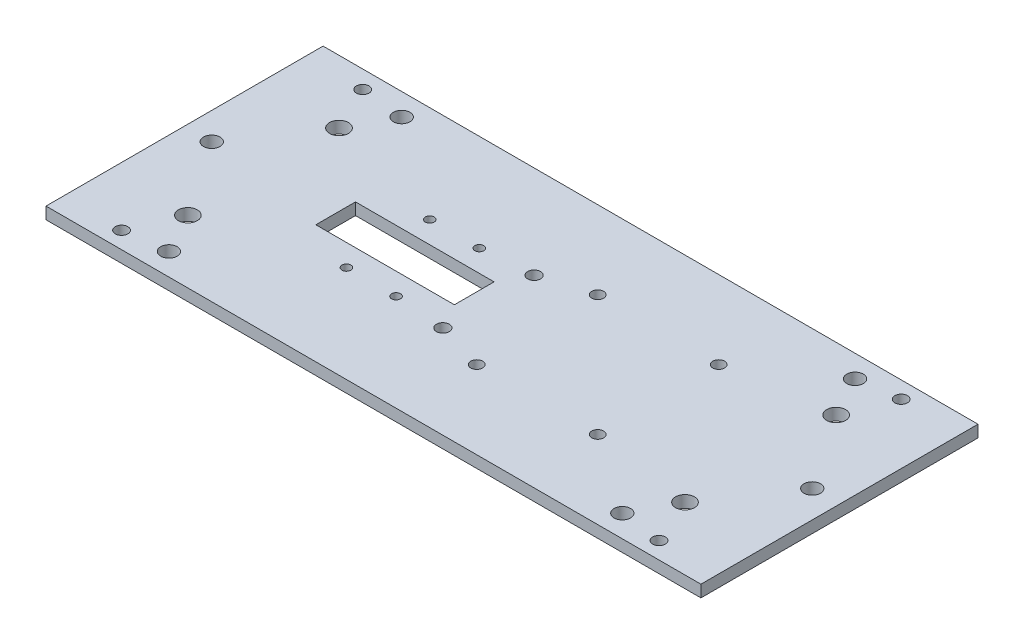
from build123d import *

# Parameters (mm, degrees)
SKETCH1_W           = 165.1
SKETCH1_H           = 69.85
BOSS_EXTRUDE1_DEPTH = 3
CUT_EXTRUDE1_REACH  = 91.684
SKETCH6_W           = 34.925
SKETCH6_H           = 10
SKETCH6_R           = 1.5
SKETCH6_R_2         = 1.625
CUT_EXTRUDE3_REACH  = 91.684
SKETCH8_R           = 2.38125
SKETCH9_R           = 2.0828
CUT_EXTRUDE5_DEPTH  = 5.08
SKETCH10_R          = 2.0828
CUT_EXTRUDE6_DEPTH  = 5.08
SKETCH11_R          = 1.125
SKETCH11_R_2        = 1.125000036
CUT_EXTRUDE7_DEPTH  = 41.91
SKETCH13_R          = 1.5875
CUT_EXTRUDE9_DEPTH  = 5


with BuildPart() as part:
    # Sketch1 → Boss-Extrude1 (new body)
    with BuildSketch(Plane(origin=(0, 0, 0), x_dir=(1, 0, 0), z_dir=(0, 1, 0))):
        Rectangle(SKETCH1_W, SKETCH1_H)
    extrude(amount=BOSS_EXTRUDE1_DEPTH)

    # Sketch6 → Cut-Extrude1 (cut, up to next)
    with BuildSketch(Plane.XZ, mode=Mode.PRIVATE) as cut_extrude1_sk1:
        with Locations((-26.9875, 0)):
            Rectangle(SKETCH6_W, SKETCH6_H)
    cut_extrude1_tool1 = extrude(cut_extrude1_sk1.sketch, amount=-CUT_EXTRUDE1_REACH, mode=Mode.PRIVATE) & part.part
    # Sketch6 → Cut-Extrude1 (cut, up to next)
    with BuildSketch(Plane.XZ, mode=Mode.PRIVATE) as cut_extrude1_sk2:
        with Locations((6.35, 15.25)):
            Circle(SKETCH6_R)
    cut_extrude1_tool2 = extrude(cut_extrude1_sk2.sketch, amount=-CUT_EXTRUDE1_REACH, mode=Mode.PRIVATE) & part.part
    # Sketch6 → Cut-Extrude1 (cut, up to next)
    with BuildSketch(Plane.XZ, mode=Mode.PRIVATE) as cut_extrude1_sk3:
        with Locations((36.85, 15.25)):
            Circle(SKETCH6_R)
    cut_extrude1_tool3 = extrude(cut_extrude1_sk3.sketch, amount=-CUT_EXTRUDE1_REACH, mode=Mode.PRIVATE) & part.part
    # Sketch6 → Cut-Extrude1 (cut, up to next)
    with BuildSketch(Plane.XZ, mode=Mode.PRIVATE) as cut_extrude1_sk4:
        with Locations((6.35, -15.25)):
            Circle(SKETCH6_R)
    cut_extrude1_tool4 = extrude(cut_extrude1_sk4.sketch, amount=-CUT_EXTRUDE1_REACH, mode=Mode.PRIVATE) & part.part
    # Sketch6 → Cut-Extrude1 (cut, up to next)
    with BuildSketch(Plane.XZ, mode=Mode.PRIVATE) as cut_extrude1_sk5:
        with Locations((36.85, -15.25)):
            Circle(SKETCH6_R)
    cut_extrude1_tool5 = extrude(cut_extrude1_sk5.sketch, amount=-CUT_EXTRUDE1_REACH, mode=Mode.PRIVATE) & part.part
    # Sketch6 → Cut-Extrude1 (cut, up to next)
    with BuildSketch(Plane.XZ, mode=Mode.PRIVATE) as cut_extrude1_sk6:
        with Locations((-5.924999961, 11.500993)):
            Circle(SKETCH6_R_2)
    cut_extrude1_tool6 = extrude(cut_extrude1_sk6.sketch, amount=-CUT_EXTRUDE1_REACH, mode=Mode.PRIVATE) & part.part
    # Sketch6 → Cut-Extrude1 (cut, up to next)
    with BuildSketch(Plane.XZ, mode=Mode.PRIVATE) as cut_extrude1_sk7:
        with Locations((-5.924999961, -11.500993)):
            Circle(SKETCH6_R_2)
    cut_extrude1_tool7 = extrude(cut_extrude1_sk7.sketch, amount=-CUT_EXTRUDE1_REACH, mode=Mode.PRIVATE) & part.part
    add(cut_extrude1_tool1.solids().sort_by_distance((-26.9875, 0, 0))[0], mode=Mode.SUBTRACT)
    add(cut_extrude1_tool2.solids().sort_by_distance((6.35, 0, 15.25))[0], mode=Mode.SUBTRACT)
    add(cut_extrude1_tool3.solids().sort_by_distance((36.85, 0, 15.25))[0], mode=Mode.SUBTRACT)
    add(cut_extrude1_tool4.solids().sort_by_distance((6.35, 0, -15.25))[0], mode=Mode.SUBTRACT)
    add(cut_extrude1_tool5.solids().sort_by_distance((36.85, 0, -15.25))[0], mode=Mode.SUBTRACT)
    add(cut_extrude1_tool6.solids().sort_by_distance((-5.925, 0, 11.500993))[0], mode=Mode.SUBTRACT)
    add(cut_extrude1_tool7.solids().sort_by_distance((-5.925, 0, -11.500993))[0], mode=Mode.SUBTRACT)

    # Sketch8 → Cut-Extrude3 (cut, up to next)
    with BuildSketch(Plane(origin=(0, 3, 0), x_dir=(1, 0, 0), z_dir=(0, 1, 0)), mode=Mode.PRIVATE) as cut_extrude3_sk1:
        with Locations((-62.6618, -19.05)):
            Circle(SKETCH8_R)
    cut_extrude3_tool1 = extrude(cut_extrude3_sk1.sketch, amount=-CUT_EXTRUDE3_REACH, mode=Mode.PRIVATE) & part.part
    # Sketch8 → Cut-Extrude3 (cut, up to next)
    with BuildSketch(Plane(origin=(0, 3, 0), x_dir=(1, 0, 0), z_dir=(0, 1, 0)), mode=Mode.PRIVATE) as cut_extrude3_sk2:
        with Locations((-62.6618, 19.05)):
            Circle(SKETCH8_R)
    cut_extrude3_tool2 = extrude(cut_extrude3_sk2.sketch, amount=-CUT_EXTRUDE3_REACH, mode=Mode.PRIVATE) & part.part
    # Sketch8 → Cut-Extrude3 (cut, up to next)
    with BuildSketch(Plane(origin=(0, 3, 0), x_dir=(1, 0, 0), z_dir=(0, 1, 0)), mode=Mode.PRIVATE) as cut_extrude3_sk3:
        with Locations((62.6618, 19.05)):
            Circle(SKETCH8_R)
    cut_extrude3_tool3 = extrude(cut_extrude3_sk3.sketch, amount=-CUT_EXTRUDE3_REACH, mode=Mode.PRIVATE) & part.part
    # Sketch8 → Cut-Extrude3 (cut, up to next)
    with BuildSketch(Plane(origin=(0, 3, 0), x_dir=(1, 0, 0), z_dir=(0, 1, 0)), mode=Mode.PRIVATE) as cut_extrude3_sk4:
        with Locations((62.6618, -19.05)):
            Circle(SKETCH8_R)
    cut_extrude3_tool4 = extrude(cut_extrude3_sk4.sketch, amount=-CUT_EXTRUDE3_REACH, mode=Mode.PRIVATE) & part.part
    add(cut_extrude3_tool1.solids().sort_by_distance((-62.6618, 3, 19.05))[0], mode=Mode.SUBTRACT)
    add(cut_extrude3_tool2.solids().sort_by_distance((-62.6618, 3, -19.05))[0], mode=Mode.SUBTRACT)
    add(cut_extrude3_tool3.solids().sort_by_distance((62.6618, 3, -19.05))[0], mode=Mode.SUBTRACT)
    add(cut_extrude3_tool4.solids().sort_by_distance((62.6618, 3, 19.05))[0], mode=Mode.SUBTRACT)

    # Sketch9 → Cut-Extrude5 (cut)
    with BuildSketch(Plane(origin=(0, 3, 0), x_dir=(1, 0, 0), z_dir=(0, 1, 0))):
        with Locations((-75.692, 0)):
            Circle(SKETCH9_R)
        with Locations((75.692, 0)):
            Circle(SKETCH9_R)
    extrude(amount=-CUT_EXTRUDE5_DEPTH, mode=Mode.SUBTRACT)

    # Sketch10 → Cut-Extrude6 (cut)
    with BuildSketch(Plane(origin=(0, 3, 0), x_dir=(1, 0, 0), z_dir=(0, 1, 0))):
        with Locations((57.15, -29.337)):
            Circle(SKETCH10_R)
        with Locations((57.15, 29.337)):
            Circle(SKETCH10_R)
        with Locations((-57.15, -29.337)):
            Circle(SKETCH10_R)
        with Locations((-57.15, 29.337)):
            Circle(SKETCH10_R)
    extrude(amount=-CUT_EXTRUDE6_DEPTH, mode=Mode.SUBTRACT)

    # Sketch11 → Cut-Extrude7 (cut)
    with BuildSketch(Plane(origin=(0, 3, 0), x_dir=(1, 0, 0), z_dir=(0, 1, 0))):
        with Locations((-31.2375, 10.5)):
            Circle(SKETCH11_R)
        with Locations((-18.7375, 10.5)):
            Circle(SKETCH11_R_2)
        with Locations((-18.7375, -10.5)):
            Circle(SKETCH11_R_2)
        with Locations((-31.2375, -10.5)):
            Circle(SKETCH11_R_2)
    extrude(amount=-CUT_EXTRUDE7_DEPTH, mode=Mode.SUBTRACT)

    # Sketch13 → Cut-Extrude9 (cut)
    with BuildSketch(Plane.XZ):
        with Locations((-67.742170098, 30.689580734)):
            Circle(SKETCH13_R)
        with Locations((67.742170098, 30.689580734)):
            Circle(SKETCH13_R)
        with Locations((67.411970098, -30.689580734)):
            Circle(SKETCH13_R)
        with Locations((-68.072141103, -30.440481299)):
            Circle(SKETCH13_R)
    extrude(amount=-CUT_EXTRUDE9_DEPTH, mode=Mode.SUBTRACT)


solid = part.part
